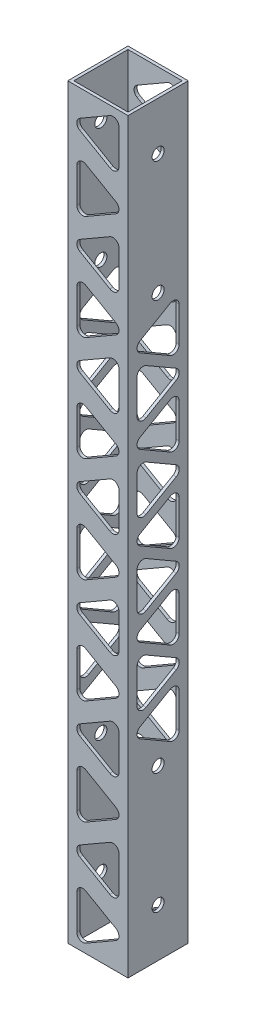
from build123d import *

# Parameters (mm, degrees)
SKETCH1_W           = 63.5
SKETCH1_H           = 63.5
SKETCH1_W_2         = 57.15
SKETCH1_H_2         = 57.15
BOSS_EXTRUDE1_DEPTH = 787.4
SKETCH2_R           = 6.35
CUT_EXTRUDE1_DEPTH  = 791.594126275
CUT_EXTRUDE2_DEPTH  = 71.12
CUT_EXTRUDE3_DEPTH  = 71.12


with BuildPart() as part:
    # Sketch1 → Boss-Extrude1 (new body)
    with BuildSketch(Plane(origin=(0, 0, 0), x_dir=(1, 0, 0), z_dir=(0, 1, 0))):
        Rectangle(SKETCH1_W, SKETCH1_H)
        Rectangle(SKETCH1_W_2, SKETCH1_H_2, mode=Mode.SUBTRACT)
    extrude(amount=BOSS_EXTRUDE1_DEPTH)

    # Sketch2 → Cut-Extrude1 (cut, through all)
    with BuildSketch(Plane.ZY.offset(31.75)):
        with Locations((0, 50.8)):
            Circle(SKETCH2_R)
        with Locations((0, 177.8)):
            Circle(SKETCH2_R)
        with Locations((0, 609.6)):
            Circle(SKETCH2_R)
        with Locations((0, 736.6)):
            Circle(SKETCH2_R)
    extrude(amount=-CUT_EXTRUDE1_DEPTH, mode=Mode.SUBTRACT)

    # Sketch3 → Cut-Extrude2 (cut)
    with BuildSketch(Plane(origin=(31.75, 0, 0), x_dir=(0, 0, -1), z_dir=(1, 0, 0))):
        with BuildLine():
            Line((-19.05, 212.005871047), (12.7, 193.675))
            ThreePointArc((12.7, 193.675), (19.05, 193.675), (22.225, 199.174261314))
            Line((22.225, 199.174261314), (22.225, 235.836003408))
            ThreePointArc((22.225, 235.836003408), (19.05, 241.335264722), (12.7, 241.335264722))
            Line((12.7, 241.335264722), (-19.05, 223.004393675))
            ThreePointArc((-19.05, 223.004393675), (-22.225, 217.505132361), (-19.05, 212.005871047))
        make_face()
        with BuildLine():
            Line((19.05, 266.998484187), (-12.7, 285.329355234))
            ThreePointArc((-12.7, 285.329355234), (-19.05, 285.329355234), (-22.225, 279.83009392))
            Line((-22.225, 279.83009392), (-22.225, 243.168351826))
            ThreePointArc((-22.225, 243.168351826), (-19.05, 237.669090512), (-12.7, 237.669090512))
            Line((-12.7, 237.669090512), (19.05, 255.999961559))
            ThreePointArc((19.05, 255.999961559), (22.225, 261.499222873), (19.05, 266.998484187))
        make_face()
        with BuildLine():
            Line((-19.05, 300.103304866), (12.7, 281.77243382))
            ThreePointArc((12.7, 281.77243382), (19.05, 281.77243382), (22.225, 287.271695134))
            Line((22.225, 287.271695134), (22.225, 323.933437227))
            ThreePointArc((22.225, 323.933437227), (19.05, 329.432698541), (12.7, 329.432698541))
            Line((12.7, 329.432698541), (-19.05, 311.101827494))
            ThreePointArc((-19.05, 311.101827494), (-22.225, 305.60256618), (-19.05, 300.103304866))
        make_face()
        with BuildLine():
            Line((19.05, 355.095918007), (-12.7, 373.426789053))
            ThreePointArc((-12.7, 373.426789053), (-19.05, 373.426789053), (-22.225, 367.927527739))
            Line((-22.225, 367.927527739), (-22.225, 331.265785646))
            ThreePointArc((-22.225, 331.265785646), (-19.05, 325.766524332), (-12.7, 325.766524332))
            Line((-12.7, 325.766524332), (19.05, 344.097395379))
            ThreePointArc((19.05, 344.097395379), (22.225, 349.596656693), (19.05, 355.095918007))
        make_face()
        with BuildLine():
            Line((-19.05, 388.200738686), (12.7, 369.869867639))
            ThreePointArc((12.7, 369.869867639), (19.05, 369.869867639), (22.225, 375.369128953))
            Line((22.225, 375.369128953), (22.225, 412.030871047))
            ThreePointArc((22.225, 412.030871047), (19.05, 417.530132361), (12.7, 417.530132361))
            Line((12.7, 417.530132361), (-19.05, 399.199261314))
            ThreePointArc((-19.05, 399.199261314), (-22.225, 393.7), (-19.05, 388.200738686))
        make_face()
        with BuildLine():
            Line((19.05, 443.193351826), (-12.7, 461.524222873))
            ThreePointArc((-12.7, 461.524222873), (-19.05, 461.524222873), (-22.225, 456.024961559))
            Line((-22.225, 456.024961559), (-22.225, 419.363219465))
            ThreePointArc((-22.225, 419.363219465), (-19.05, 413.863958151), (-12.7, 413.863958151))
            Line((-12.7, 413.863958151), (19.05, 432.194829198))
            ThreePointArc((19.05, 432.194829198), (22.225, 437.694090512), (19.05, 443.193351826))
        make_face()
        with BuildLine():
            Line((-19.05, 476.298172506), (12.7, 457.967301459))
            ThreePointArc((12.7, 457.967301459), (19.05, 457.967301459), (22.225, 463.466562773))
            Line((22.225, 463.466562773), (22.225, 500.128304866))
            ThreePointArc((22.225, 500.128304866), (19.05, 505.62756618), (12.7, 505.62756618))
            Line((12.7, 505.62756618), (-19.05, 487.296695134))
            ThreePointArc((-19.05, 487.296695134), (-22.225, 481.79743382), (-19.05, 476.298172506))
        make_face()
        with BuildLine():
            Line((19.05, 531.290785646), (-12.7, 549.621656693))
            ThreePointArc((-12.7, 549.621656693), (-19.05, 549.621656693), (-22.225, 544.122395379))
            Line((-22.225, 544.122395379), (-22.225, 507.460653285))
            ThreePointArc((-22.225, 507.460653285), (-19.05, 501.961391971), (-12.7, 501.961391971))
            Line((-12.7, 501.961391971), (19.05, 520.292263018))
            ThreePointArc((19.05, 520.292263018), (22.225, 525.791524332), (19.05, 531.290785646))
        make_face()
        with BuildLine():
            Line((-19.05, 564.395606325), (12.7, 546.064735278))
            ThreePointArc((12.7, 546.064735278), (19.05, 546.064735278), (22.225, 551.563996592))
            Line((22.225, 551.563996592), (22.225, 588.225738686))
            ThreePointArc((22.225, 588.225738686), (19.05, 593.725), (12.7, 593.725))
            Line((12.7, 593.725), (-19.05, 575.394128953))
            ThreePointArc((-19.05, 575.394128953), (-22.225, 569.894867639), (-19.05, 564.395606325))
        make_face()
    extrude(amount=-CUT_EXTRUDE2_DEPTH, mode=Mode.SUBTRACT)

    # Sketch5 → Cut-Extrude3 (cut)
    with BuildSketch(Plane(origin=(0, 0, -31.75), x_dir=(-1, 0, 0), z_dir=(0, 0, -1))):
        with BuildLine():
            Line((19.05, 759.544128953), (-12.7, 777.875))
            ThreePointArc((-12.7, 777.875), (-19.05, 777.875), (-22.225, 772.375738686))
            Line((-22.225, 772.375738686), (-22.225, 735.713996592))
            ThreePointArc((-22.225, 735.713996592), (-19.05, 730.214735278), (-12.7, 730.214735278))
            Line((-12.7, 730.214735278), (19.05, 748.545606325))
            ThreePointArc((19.05, 748.545606325), (22.225, 754.044867639), (19.05, 759.544128953))
        make_face()
        with BuildLine():
            Line((-19.05, 691.360341604), (12.7, 673.029470557))
            ThreePointArc((12.7, 673.029470557), (19.05, 673.029470557), (22.225, 678.528731871))
            Line((22.225, 678.528731871), (22.225, 715.190473964))
            ThreePointArc((22.225, 715.190473964), (19.05, 720.689735278), (12.7, 720.689735278))
            Line((12.7, 720.689735278), (-19.05, 702.358864232))
            ThreePointArc((-19.05, 702.358864232), (-22.225, 696.859602918), (-19.05, 691.360341604))
        make_face()
        with BuildLine():
            Line((19.05, 648.960050527), (-12.7, 667.290921574))
            ThreePointArc((-12.7, 667.290921574), (-19.05, 667.290921574), (-22.225, 661.79166026))
            Line((-22.225, 661.79166026), (-22.225, 625.129918166))
            ThreePointArc((-22.225, 625.129918166), (-19.05, 619.630656852), (-12.7, 619.630656852))
            Line((-12.7, 619.630656852), (19.05, 637.961527899))
            ThreePointArc((19.05, 637.961527899), (22.225, 643.460789213), (19.05, 648.960050527))
        make_face()
        with BuildLine():
            Line((-19.05, 580.776263177), (12.7, 562.445392131))
            ThreePointArc((12.7, 562.445392131), (19.05, 562.445392131), (22.225, 567.944653445))
            Line((22.225, 567.944653445), (22.225, 604.606395538))
            ThreePointArc((22.225, 604.606395538), (19.05, 610.105656852), (12.7, 610.105656852))
            Line((12.7, 610.105656852), (-19.05, 591.774785805))
            ThreePointArc((-19.05, 591.774785805), (-22.225, 586.275524491), (-19.05, 580.776263177))
        make_face()
        with BuildLine():
            Line((19.05, 538.375972101), (-12.7, 556.706843148))
            ThreePointArc((-12.7, 556.706843148), (-19.05, 556.706843148), (-22.225, 551.207581834))
            Line((-22.225, 551.207581834), (-22.225, 514.54583974))
            ThreePointArc((-22.225, 514.54583974), (-19.05, 509.046578426), (-12.7, 509.046578426))
            Line((-12.7, 509.046578426), (19.05, 527.377449473))
            ThreePointArc((19.05, 527.377449473), (22.225, 532.876710787), (19.05, 538.375972101))
        make_face()
        with BuildLine():
            Line((-19.05, 470.192184751), (12.7, 451.861313705))
            ThreePointArc((12.7, 451.861313705), (19.05, 451.861313705), (22.225, 457.360575019))
            Line((22.225, 457.360575019), (22.225, 494.022317112))
            ThreePointArc((22.225, 494.022317112), (19.05, 499.521578426), (12.7, 499.521578426))
            Line((12.7, 499.521578426), (-19.05, 481.190707379))
            ThreePointArc((-19.05, 481.190707379), (-22.225, 475.691446065), (-19.05, 470.192184751))
        make_face()
        with BuildLine():
            Line((19.05, 427.791893675), (-12.7, 446.122764722))
            ThreePointArc((-12.7, 446.122764722), (-19.05, 446.122764722), (-22.225, 440.623503408))
            Line((-22.225, 440.623503408), (-22.225, 403.961761314))
            ThreePointArc((-22.225, 403.961761314), (-19.05, 398.4625), (-12.7, 398.4625))
            Line((-12.7, 398.4625), (19.05, 416.793371047))
            ThreePointArc((19.05, 416.793371047), (22.225, 422.292632361), (19.05, 427.791893675))
        make_face()
        with BuildLine():
            Line((-19.05, 359.608106325), (12.7, 341.277235278))
            ThreePointArc((12.7, 341.277235278), (19.05, 341.277235278), (22.225, 346.776496592))
            Line((22.225, 346.776496592), (22.225, 383.438238686))
            ThreePointArc((22.225, 383.438238686), (19.05, 388.9375), (12.7, 388.9375))
            Line((12.7, 388.9375), (-19.05, 370.606628953))
            ThreePointArc((-19.05, 370.606628953), (-22.225, 365.107367639), (-19.05, 359.608106325))
        make_face()
        with BuildLine():
            Line((19.05, 317.207815249), (-12.7, 335.538686295))
            ThreePointArc((-12.7, 335.538686295), (-19.05, 335.538686295), (-22.225, 330.039424981))
            Line((-22.225, 330.039424981), (-22.225, 293.377682888))
            ThreePointArc((-22.225, 293.377682888), (-19.05, 287.878421574), (-12.7, 287.878421574))
            Line((-12.7, 287.878421574), (19.05, 306.209292621))
            ThreePointArc((19.05, 306.209292621), (22.225, 311.708553935), (19.05, 317.207815249))
        make_face()
        with BuildLine():
            Line((-19.05, 249.024027899), (12.7, 230.693156852))
            ThreePointArc((12.7, 230.693156852), (19.05, 230.693156852), (22.225, 236.192418166))
            Line((22.225, 236.192418166), (22.225, 272.85416026))
            ThreePointArc((22.225, 272.85416026), (19.05, 278.353421574), (12.7, 278.353421574))
            Line((12.7, 278.353421574), (-19.05, 260.022550527))
            ThreePointArc((-19.05, 260.022550527), (-22.225, 254.523289213), (-19.05, 249.024027899))
        make_face()
        with BuildLine():
            Line((19.05, 206.623736823), (-12.7, 224.954607869))
            ThreePointArc((-12.7, 224.954607869), (-19.05, 224.954607869), (-22.225, 219.455346555))
            Line((-22.225, 219.455346555), (-22.225, 182.793604462))
            ThreePointArc((-22.225, 182.793604462), (-19.05, 177.294343148), (-12.7, 177.294343148))
            Line((-12.7, 177.294343148), (19.05, 195.625214195))
            ThreePointArc((19.05, 195.625214195), (22.225, 201.124475509), (19.05, 206.623736823))
        make_face()
        with BuildLine():
            Line((-19.05, 138.439949473), (12.7, 120.109078426))
            ThreePointArc((12.7, 120.109078426), (19.05, 120.109078426), (22.225, 125.60833974))
            Line((22.225, 125.60833974), (22.225, 162.270081834))
            ThreePointArc((22.225, 162.270081834), (19.05, 167.769343148), (12.7, 167.769343148))
            Line((12.7, 167.769343148), (-19.05, 149.438472101))
            ThreePointArc((-19.05, 149.438472101), (-22.225, 143.939210787), (-19.05, 138.439949473))
        make_face()
        with BuildLine():
            Line((19.05, 96.039658396), (-12.7, 114.370529443))
            ThreePointArc((-12.7, 114.370529443), (-19.05, 114.370529443), (-22.225, 108.871268129))
            Line((-22.225, 108.871268129), (-22.225, 72.209526036))
            ThreePointArc((-22.225, 72.209526036), (-19.05, 66.710264722), (-12.7, 66.710264722))
            Line((-12.7, 66.710264722), (19.05, 85.041135768))
            ThreePointArc((19.05, 85.041135768), (22.225, 90.540397082), (19.05, 96.039658396))
        make_face()
        with BuildLine():
            Line((-19.05, 27.855871047), (12.7, 9.525))
            ThreePointArc((12.7, 9.525), (19.05, 9.525), (22.225, 15.024261314))
            Line((22.225, 15.024261314), (22.225, 51.686003408))
            ThreePointArc((22.225, 51.686003408), (19.05, 57.185264722), (12.7, 57.185264722))
            Line((12.7, 57.185264722), (-19.05, 38.854393675))
            ThreePointArc((-19.05, 38.854393675), (-22.225, 33.355132361), (-19.05, 27.855871047))
        make_face()
    extrude(amount=-CUT_EXTRUDE3_DEPTH, mode=Mode.SUBTRACT)


solid = part.part
